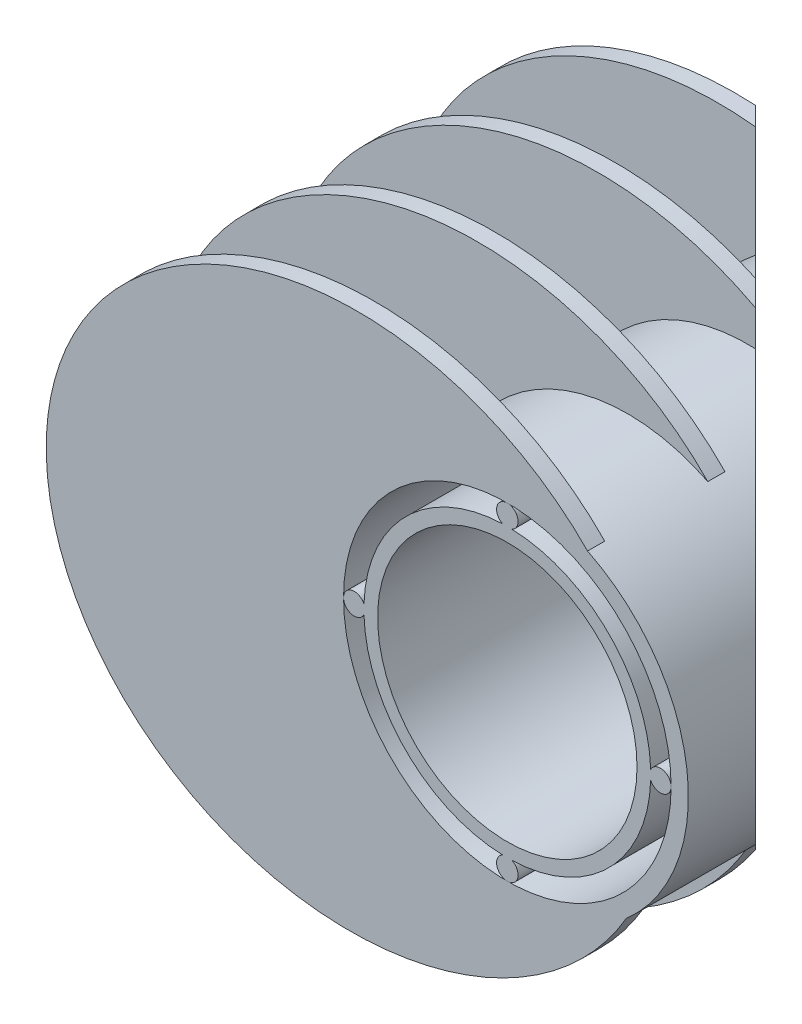
from build123d import *

# Parameters (mm, degrees)
SKETCH1_R           = 21.08
SKETCH1_R_2         = 19.07
BOSS_EXTRUDE1_DEPTH = 50
SKETCH3_R           = 16.7
SKETCH3_R_2         = 15.1
BOSS_EXTRUDE2_DEPTH = 50
SKETCH4_R           = 1.25
BOSS_EXTRUDE3_DEPTH = 50
BOSS_EXTRUDE4_DEPTH = 2
LPATTERN2_COUNT     = 4
LPATTERN2_PITCH     = 14
CUT_EXTRUDE1_DEPTH  = 76.5


with BuildPart() as part:
    # Sketch1 → Boss-Extrude1 (new body)
    with BuildSketch(Plane.XY):
        Circle(SKETCH1_R)
        Circle(SKETCH1_R_2, mode=Mode.SUBTRACT)
    extrude(amount=-BOSS_EXTRUDE1_DEPTH)

    # Sketch5 → Boss-Extrude4 (add)
    with BuildSketch(Plane.XY):
        with BuildLine():
            ThreePointArc((9.341355467, 18.897234666), (-20.905062648, -2.71012097), (13.8512264, -15.890560947))
            add(Edge.make_bspline(
                [(9.341355467, 18.897234666), (-66.747317729, 96.790361583), (-53.454080602, -5.749694014), (-40.160843475, -108.289749611), (13.8512264, -15.890560947)],
                knots=[0.660467812, 0.660467812, 0.660467812, 3.211035022, 3.211035022, 5.761602231, 5.761602231, 5.761602231], degree=2, weights=[1, 0.291230385, 1, 0.291230385, 1]))
        make_face()
    boss_extrude4 = extrude(amount=-BOSS_EXTRUDE4_DEPTH)

    # LPattern2: Boss-Extrude4 ×4
    with Locations(*[(0, 0, -i * LPATTERN2_PITCH) for i in range(1, LPATTERN2_COUNT)]):
        add(boss_extrude4)


with BuildPart() as body_2:
    # Sketch3 → Boss-Extrude2 (new body)
    with BuildSketch(Plane.XY):
        Circle(SKETCH3_R)
        Circle(SKETCH3_R_2, mode=Mode.SUBTRACT)
    extrude(amount=-BOSS_EXTRUDE2_DEPTH)

    # Sketch4 → Boss-Extrude3 (add)
    with BuildSketch(Plane.XY):
        with Locations((0, -17.82)):
            Circle(SKETCH4_R)
        with Locations((-17.82, 0)):
            Circle(SKETCH4_R)
        with Locations((0, 17.82)):
            Circle(SKETCH4_R)
        with Locations((17.82, 0)):
            Circle(SKETCH4_R)
    extrude(amount=-BOSS_EXTRUDE3_DEPTH)


with BuildPart() as cut_extrude1_tool:
    # Sketch2 → Cut-Extrude1 (new, symmetric)
    with BuildSketch(Plane(origin=(0, 0, 0), x_dir=(1, 0, 0), z_dir=(0, 1, 0))):
        Polygon((-21.08, 50), (21.08, 7.84), (21.08, 50), align=None)
    extrude(amount=CUT_EXTRUDE1_DEPTH, both=True)


with BuildPart() as part_1:
    add(part.part)

    # Cut-Extrude1: cut by cut_extrude1_tool
    add(cut_extrude1_tool.part, mode=Mode.SUBTRACT)


with BuildPart() as body_2_1:
    add(body_2.part)

    # Cut-Extrude1: cut by cut_extrude1_tool
    add(cut_extrude1_tool.part, mode=Mode.SUBTRACT)


solid = Compound([part_1.part, body_2_1.part])
